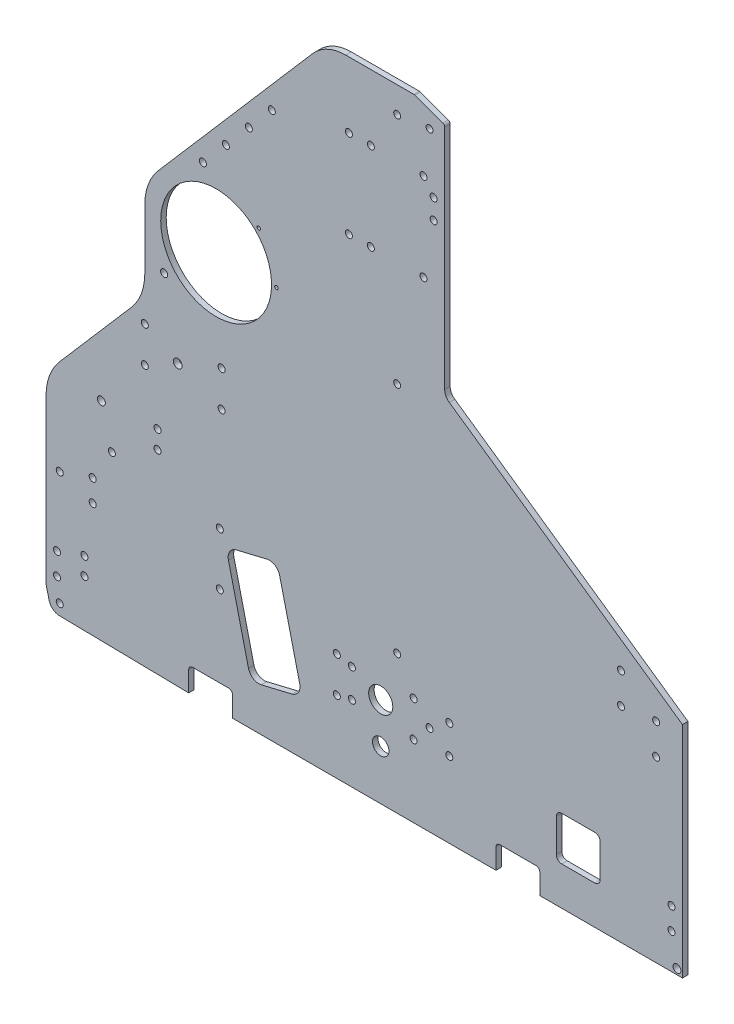
from build123d import *

# Parameters (mm, degrees)
SKETCH1_R           = 2.032
SKETCH1_R_2         = 2.54
SKETCH1_R_3         = 2
BOSS_EXTRUDE1_DEPTH = 3.175
FILLET1_R           = 2.286
FILLET2_R           = 6.35
SKETCH2_R           = 2.032
CUT_EXTRUDE1_DEPTH  = 505.524983177
FILLET3_R           = 1.5875
SKETCH3_R           = 2.032
SKETCH3_R_2         = 2.286
SKETCH3_R_3         = 1.016
CUT_EXTRUDE2_DEPTH  = 505.524983177
SKETCH4_R           = 2.032
SKETCH4_R_2         = 6.985
SKETCH4_R_3         = 4.7625
CUT_EXTRUDE3_DEPTH  = 505.524983177
SKETCH5_R           = 32.0675
SKETCH5_R_2         = 2.286000001
CUT_EXTRUDE5_DEPTH  = 540.282512257
FILLET4_R           = 31.75
CUT_EXTRUDE6_DEPTH  = 505.524983177
FILLET5_R           = 25.4
SKETCH8_R           = 2.032
CUT_EXTRUDE7_DEPTH  = 505.524983177


with BuildPart() as part:
    # Sketch1 → Boss-Extrude1 (new body)
    with BuildSketch(Plane.XY):
        with BuildLine():
            Line((7.829508682, -19.049081656), (82.55, -20.32))
            Line((82.55, -20.32), (82.55, -6.35))
            Line((82.55, -6.35), (107.95, -6.35))
            Line((107.95, -6.35), (107.95, -20.32))
            Line((107.95, -20.32), (260.35, -20.32))
            Line((260.35, -20.32), (260.35, -6.35))
            Line((260.35, -6.35), (285.75, -6.35))
            Line((285.75, -6.35), (285.75, -20.32))
            Line((285.75, -20.32), (368.3, -20.32))
            Line((368.3, -20.32), (368.3, 106.68))
            Line((368.3, 106.68), (230.66375, 202.565))
            Line((230.66375, 202.565), (230.66375, 338.455))
            Line((230.66375, 338.455), (213.19998, 344.805))
            Line((213.19998, 344.805), (203.2, 344.805))
            Line((203.2, 344.805), (161.925, 344.805))
            Line((161.925, 344.805), (52.720122664, 218.469945827))
            ThreePointArc((52.720122664, 218.469945827), (52.803835479, 218.142145922), (52.832, 217.805))
            ThreePointArc((52.832, 217.805), (52.095493096, 216.239521914), (50.419872403, 215.808871996))
            Line((50.419872403, 215.808871996), (0, 157.48))
            Line((0, 157.48), (0, 0))
            Line((0, 0), (0, -6.35))
            ThreePointArc((0, -6.35), (0.047577015, -7.125863724), (0.189595124, -7.890101219))
            Line((0.189595124, -7.890101219), (1.777095124, -14.240101219))
            ThreePointArc((1.777095124, -14.240101219), (3.987212552, -17.671692778), (7.829508682, -19.049081656))
        make_face()
        with Locations((7.9375, -12.7)):
            Circle(SKETCH1_R, mode=Mode.SUBTRACT)
        with Locations((6.35, 0)):
            Circle(SKETCH1_R, mode=Mode.SUBTRACT)
        with Locations((6.35, 12.7)):
            Circle(SKETCH1_R, mode=Mode.SUBTRACT)
        with Locations((38.1, 78.105)):
            Circle(SKETCH1_R, mode=Mode.SUBTRACT)
        with Locations((57.15, 131.28625)):
            Circle(SKETCH1_R, mode=Mode.SUBTRACT)
        with Locations((57.15, 151.92375)):
            Circle(SKETCH1_R, mode=Mode.SUBTRACT)
        with Locations((76.2, 141.605)):
            Circle(SKETCH1_R_2, mode=Mode.SUBTRACT)
        with Locations((101.6, 131.28625)):
            Circle(SKETCH1_R, mode=Mode.SUBTRACT)
        with Locations((101.6, 151.92375)):
            Circle(SKETCH1_R, mode=Mode.SUBTRACT)
        with Locations((203.2, 59.805)):
            Circle(SKETCH1_R_3, mode=Mode.SUBTRACT)
        with Locations((361.95, 0)):
            Circle(SKETCH1_R, mode=Mode.SUBTRACT)
        with Locations((361.95, 12.7)):
            Circle(SKETCH1_R, mode=Mode.SUBTRACT)
        with Locations((353.06, 82.955052336)):
            Circle(SKETCH1_R, mode=Mode.SUBTRACT)
        with Locations((332.74, 98.195052336)):
            Circle(SKETCH1_R, mode=Mode.SUBTRACT)
        with Locations((332.74, 115.975052336)):
            Circle(SKETCH1_R, mode=Mode.SUBTRACT)
        with Locations((353.06, 100.735052336)):
            Circle(SKETCH1_R, mode=Mode.SUBTRACT)
        with Locations((68.326, 182.923674932)):
            Circle(SKETCH1_R, mode=Mode.SUBTRACT)
        with Locations((76.2, 217.805)):
            Circle(SKETCH1_R, mode=Mode.SUBTRACT)
        with Locations((90.779500502, 249.682)):
            Circle(SKETCH1_R, mode=Mode.SUBTRACT)
        with Locations((104.067838673, 265.054783374)):
            Circle(SKETCH1_R, mode=Mode.SUBTRACT)
        with Locations((117.356176844, 280.427566748)):
            Circle(SKETCH1_R, mode=Mode.SUBTRACT)
        with Locations((130.644515014, 295.800350122)):
            Circle(SKETCH1_R, mode=Mode.SUBTRACT)
        with Locations((203.2, 194.805)):
            Circle(SKETCH1_R_3, mode=Mode.SUBTRACT)
        with Locations((224.31375, 287.401)):
            Circle(SKETCH1_R, mode=Mode.SUBTRACT)
        with Locations((224.31375, 298.831)):
            Circle(SKETCH1_R, mode=Mode.SUBTRACT)
        with Locations((203.2, 329.805)):
            Circle(SKETCH1_R_3, mode=Mode.SUBTRACT)
        with Locations((221.931865, 332.105)):
            Circle(SKETCH1_R_3, mode=Mode.SUBTRACT)
    extrude(amount=BOSS_EXTRUDE1_DEPTH)

    # Fillet1
    fillet1_edges = [part.edges().sort_by_distance(p)[0] for p in [
        (285.75, -6.35, 1.5875),
        (107.95, -6.35, 1.5875),
        (260.35, -6.35, 1.5875),
        (82.55, -6.35, 1.5875),
    ]]
    fillet(fillet1_edges, radius=FILLET1_R)

    # Fillet2
    fillet2_edges = [part.edges().sort_by_distance(p)[0] for p in [
        (230.66375, 202.565, 1.5875),
    ]]
    fillet(fillet2_edges, radius=FILLET2_R)

    # Sketch2 → Cut-Extrude1 (cut, through all)
    with BuildSketch(Plane(origin=(0, 0, 0), x_dir=(-1, 0, 0), z_dir=(0, 0, -1))):
        with Locations((-100.552770272, 71.086035298)):
            Circle(SKETCH2_R)
        with Locations((-100.552770272, 40.606035298)):
            Circle(SKETCH2_R)
        with Locations((-22.225, 18.202541089)):
            Circle(SKETCH2_R)
        with Locations((-22.225, 8.042541089)):
            Circle(SKETCH2_R)
    extrude(amount=-CUT_EXTRUDE1_DEPTH, mode=Mode.SUBTRACT)

    # Fillet3
    fillet3_edges = [part.edges().sort_by_distance(p)[0] for p in [
        (230.66375, 338.455, 1.5875),
        (213.19998, 344.805, 1.5875),
    ]]
    fillet(fillet3_edges, radius=FILLET3_R)

    # Sketch3 → Cut-Extrude2 (cut, through all)
    with BuildSketch(Plane.XY.offset(3.175)):
        with BuildLine():
            Line((127.789350211, 69.359774106), (110.090750339, 65.117184968))
            ThreePointArc((110.090750339, 65.117184968), (106.287939856, 62.356288953), (105.55119507, 57.715047577))
            Line((105.55119507, 57.715047577), (117.160037875, 9.287010566))
            ThreePointArc((117.160037875, 9.287010566), (119.92093389, 5.484200083), (124.562175266, 4.747455297))
            Line((124.562175266, 4.747455297), (142.260775137, 8.990044434))
            ThreePointArc((142.260775137, 8.990044434), (146.063585621, 11.75094045), (146.800330407, 16.392181825))
            Line((146.800330407, 16.392181825), (135.191487602, 64.820218836))
            ThreePointArc((135.191487602, 64.820218836), (132.430591586, 68.62302932), (127.789350211, 69.359774106))
        make_face()
        with Locations((26.987500002, 46.953113935)):
            Circle(SKETCH3_R)
        with Locations((26.987500002, 59.653113935)):
            Circle(SKETCH3_R)
        with Locations((7.937500002, 53.303113935)):
            Circle(SKETCH3_R)
        with Locations((32.030600738, 100.810868776)):
            Circle(SKETCH3_R_2)
        with Locations((64.525942114, 102.94048958)):
            Circle(SKETCH3_R)
        with Locations((64.525942114, 92.525786339)):
            Circle(SKETCH3_R)
        with Locations((133.35, 208.228121768)):
            Circle(SKETCH3_R_3)
        with Locations((123.120704333, 232.923826101)):
            Circle(SKETCH3_R_3)
    extrude(amount=-CUT_EXTRUDE2_DEPTH, mode=Mode.SUBTRACT)

    # Sketch4 → Cut-Extrude3 (cut, through all)
    with BuildSketch(Plane.XY.offset(3.175)):
        with Locations((168.275, 42.06875)):
            Circle(SKETCH4_R)
        with Locations((212.725, 42.06875)):
            Circle(SKETCH4_R)
        with Locations((212.725, 21.43125)):
            Circle(SKETCH4_R)
        with Locations((168.275, 21.43125)):
            Circle(SKETCH4_R)
        with Locations((193.675, 31.75)):
            Circle(SKETCH4_R_2)
        with Locations((177.00498, 40.0431)):
            Circle(SKETCH4_R)
        with Locations((177.00498, 23.4569)):
            Circle(SKETCH4_R)
        with Locations((193.675, 8.466666658)):
            Circle(SKETCH4_R_3)
        with Locations((221.931865, 31.75)):
            Circle(SKETCH4_R)
        with Locations((233.36123, 23.4569)):
            Circle(SKETCH4_R)
        with Locations((233.36123, 40.0431)):
            Circle(SKETCH4_R)
    extrude(amount=-CUT_EXTRUDE3_DEPTH, mode=Mode.SUBTRACT)

    # Sketch5 → Cut-Extrude5 (cut, through all)
    with BuildSketch(Plane(origin=(0, 0, -187.325000003), x_dir=(-1, 0, 0), z_dir=(0, 0, -1))):
        Polygon((0, 157.48), (-57.15, 223.594705882), (-57.15, 165.333696112), (0, 99.218990229), align=None)
        with Locations((-98.425, 208.228121768)):
            Circle(SKETCH5_R)
        with Locations((-365.124993903, -17.144956474)):
            Circle(SKETCH5_R_2)
    extrude(amount=-CUT_EXTRUDE5_DEPTH, mode=Mode.SUBTRACT)

    # Fillet4
    fillet4_edges = [part.edges().sort_by_distance(p)[0] for p in [
        (0, 99.218990229, 1.5875),
        (57.15, 165.333696112, 1.5875),
        (57.15, 223.594705882, 1.5875),
    ]]
    fillet(fillet4_edges, radius=FILLET4_R)

    # Sketch6 → Cut-Extrude6 (cut, through all)
    with BuildSketch(Plane.XY.offset(3.175)):
        with BuildLine():
            Line((298.45, 27.305), (317.5, 27.305))
            ThreePointArc((317.5, 27.305), (319.74506403, 26.37506403), (320.675, 24.13))
            Line((320.675, 24.13), (320.675, 5.08))
            ThreePointArc((320.675, 5.08), (319.74506403, 2.83493597), (317.5, 1.905))
            Line((317.5, 1.905), (298.45, 1.905))
            ThreePointArc((298.45, 1.905), (296.20493597, 2.83493597), (295.275, 5.08))
            Line((295.275, 5.08), (295.275, 24.13))
            ThreePointArc((295.275, 24.13), (296.20493597, 26.37506403), (298.45, 27.305))
        make_face()
    extrude(amount=-CUT_EXTRUDE6_DEPTH, mode=Mode.SUBTRACT)

    # Fillet5
    fillet5_edges = [part.edges().sort_by_distance(p)[0] for p in [
        (161.925, 344.805, 1.5875),
    ]]
    fillet(fillet5_edges, radius=FILLET5_R)

    # Sketch8 → Cut-Extrude7 (cut, through all)
    with BuildSketch(Plane(origin=(0, 0, 0), x_dir=(-1, 0, 0), z_dir=(0, 0, -1))):
        with Locations((-187.96, 306.705)):
            Circle(SKETCH8_R)
        with Locations((-175.26, 306.705)):
            Circle(SKETCH8_R)
        with Locations((-218.44, 306.705)):
            Circle(SKETCH8_R)
        with Locations((-218.44, 255.905)):
            Circle(SKETCH8_R)
        with Locations((-187.96, 255.905)):
            Circle(SKETCH8_R)
        with Locations((-175.26, 255.905)):
            Circle(SKETCH8_R)
    extrude(amount=-CUT_EXTRUDE7_DEPTH, mode=Mode.SUBTRACT)


solid = part.part
